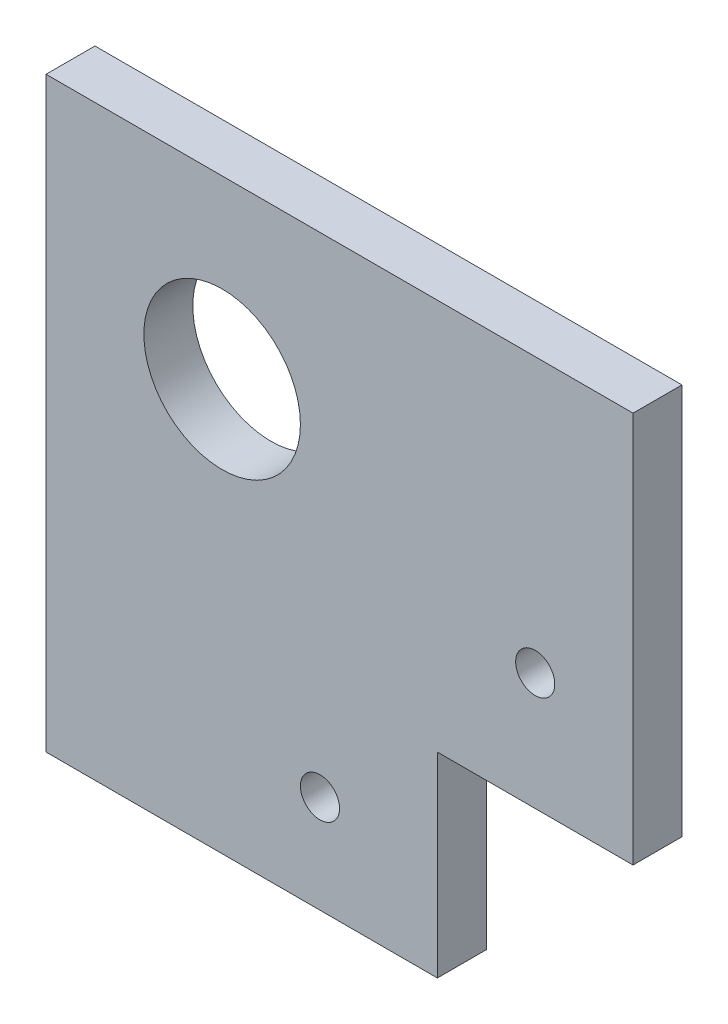
from build123d import *

# Parameters (mm, degrees)
SKETCH1_R           = 8
BOSS_EXTRUDE1_DEPTH = 5
SKETCH2_R           = 2
CUT_EXTRUDE1_DEPTH  = 86


with BuildPart() as part:
    # Sketch1 → Boss-Extrude1 (new body)
    with BuildSketch(Plane.XY):
        Polygon((0, 0), (40, 0), (40, 20), (60, 20), (60, 60), (0, 60), align=None)
        with Locations((18, 42)):
            Circle(SKETCH1_R, mode=Mode.SUBTRACT)
    extrude(amount=BOSS_EXTRUDE1_DEPTH)

    # Sketch2 → Cut-Extrude1 (cut, through all)
    with BuildSketch(Plane(origin=(0, 0, 0), x_dir=(-1, 0, 0), z_dir=(0, 0, -1))):
        with Locations((-50, 32)):
            Circle(SKETCH2_R)
        with Locations((-28, 10)):
            Circle(SKETCH2_R)
    extrude(amount=-CUT_EXTRUDE1_DEPTH, mode=Mode.SUBTRACT)


solid = part.part
